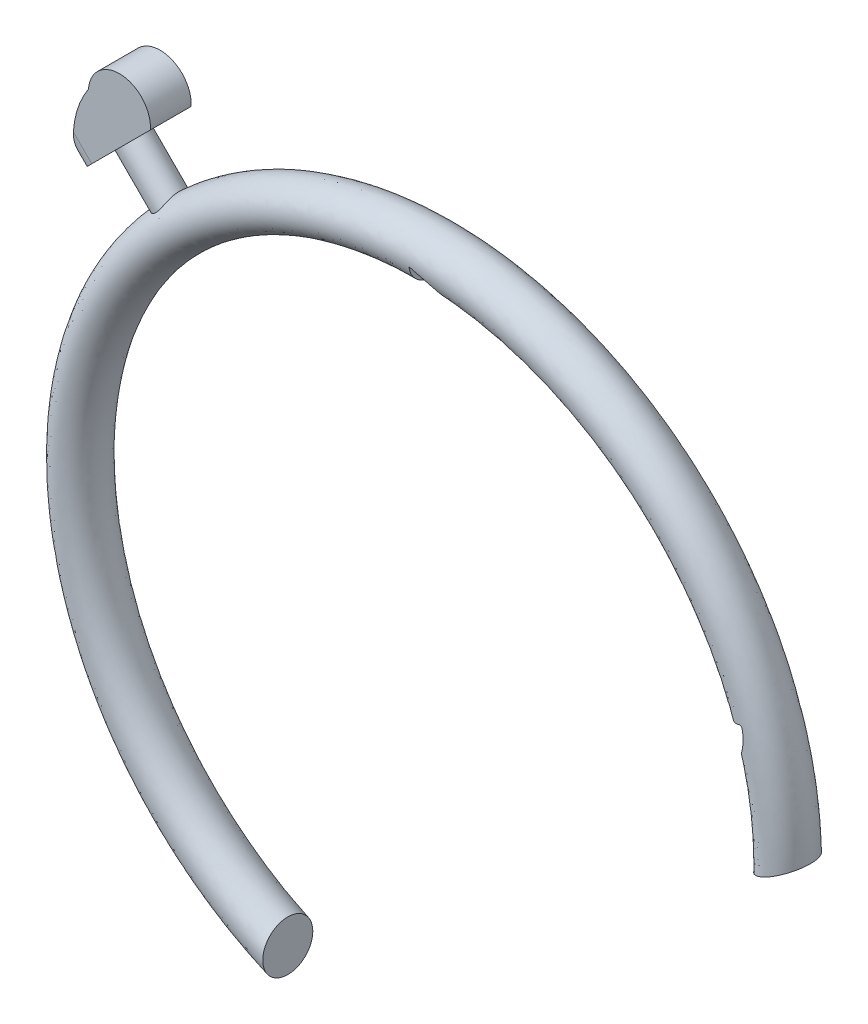
from build123d import *

# Parameters (mm, degrees)
SKETCH2_R           = 4
CUT_EXTRUDE2_DEPTH  = 5
SKETCH11_R          = 2.5
BOSS_EXTRUDE1_DEPTH = 15
BOSS_EXTRUDE2_DEPTH = 3.75
BOSS_EXTRUDE3_DEPTH = 6.5
CUT_EXTRUDE3_START  = -6.5
CUT_EXTRUDE3_DEPTH  = 6.5


# Read off the part's stored shape, not the designer's step: Cut-Extrude3
with BuildPart() as part:
    # Sweep1: sweep along a path in Sketch1
    with BuildLine(Plane.XY) as sweep1_path:
        ThreePointArc((-23.367256637, -51.441435801), (-30.594117082, 47.5), (56.5, 0))
    # Sketch2 → Sweep1 (sweep)
    with BuildSketch(Plane(origin=(-23.367256637, 0, 0), x_dir=(0, 0, -1), z_dir=(1, 0, 0))):
        with Locations((0, -51.441435801)):
            Circle(SKETCH2_R)
    sweep(path=sweep1_path.line)

    # Sketch9 → Cut-Extrude2 (cut, symmetric)
    with BuildSketch(Plane.XY):
        with BuildLine():
            Line((0, 56.5), (0, 52.884009999))
            Line((0, 52.884009999), (4.863605526, 52.659888481))
            ThreePointArc((4.863605526, 52.659888481), (3.098431667, 55.424247852), (0, 56.5))
        make_face()
        with BuildLine():
            Line((51.147559676, 13.440448383), (49.694713954, 18.08739668))
            Line((49.694713954, 18.08739668), (53.092633074, 19.324138098))
            ThreePointArc((53.092633074, 19.324138098), (53.141482762, 16.04463582), (51.147559676, 13.440448383))
        make_face()
    extrude(amount=CUT_EXTRUDE2_DEPTH, both=True, mode=Mode.SUBTRACT)

    # Sketch11 → Boss-Extrude1 (add)
    with BuildSketch(Plane(origin=(-39.951533137, 39.951533137, 0), x_dir=(0, 0, 1), z_dir=(-0.7071067811865489, 0.7071067811865461, 0))):
        with Locations(Location((0, 0, 0), (0, 0, 90))):
            Circle(SKETCH11_R)
    extrude(amount=BOSS_EXTRUDE1_DEPTH)

    # Sketch12 → Boss-Extrude2 (add, symmetric)
    with BuildSketch(Plane(origin=(-50.558134855, 50.558134855, 0), x_dir=(0, 0, 1), z_dir=(-0.7071067811865489, 0.7071067811865461, 0))):
        with BuildLine():
            Line((-3.25, -5), (-3.25, 5))
            ThreePointArc((-3.25, 5), (0, 8.25), (3.25, 5))
            Line((3.25, 5), (3.25, -5))
            ThreePointArc((3.25, -5), (0, -8.25), (-3.25, -5))
        make_face()
    extrude(amount=BOSS_EXTRUDE2_DEPTH, both=True)

    # Sketch13 → Boss-Extrude3 (add)
    with BuildSketch(Plane.XY.offset(3.25)):
        with BuildLine():
            Line((-51.972348417, 54.447222151), (-46.669047558, 49.143921292))
            Line((-46.669047558, 49.143921292), (-42.072853481, 53.74011537))
            ThreePointArc((-42.072853481, 53.74011537), (-46.669047558, 59.043416229), (-51.972348417, 54.447222151))
        make_face()
    extrude(amount=-BOSS_EXTRUDE3_DEPTH)

    # Cut-Extrude3 outline → Cut-Extrude3 (cut)
    with BuildSketch(Plane.XY.offset(3.25).offset(CUT_EXTRUDE3_START)):
        with BuildLine():
            Line((-53.402666347, 41), (-53.740112307, 42.072843742))
            ThreePointArc((-53.740112307, 42.072843742), (-54.261370112, 48.460766691), (-51.972348417, 54.447222151))
            Line((-51.972348417, 54.447222151), (-61, 45.419570568))
            Line((-61, 45.419570568), (-61, 41))
            Line((-61, 41), (-53.402666347, 41))
        make_face()
    extrude(amount=CUT_EXTRUDE3_DEPTH, mode=Mode.SUBTRACT)


solid = part.part
